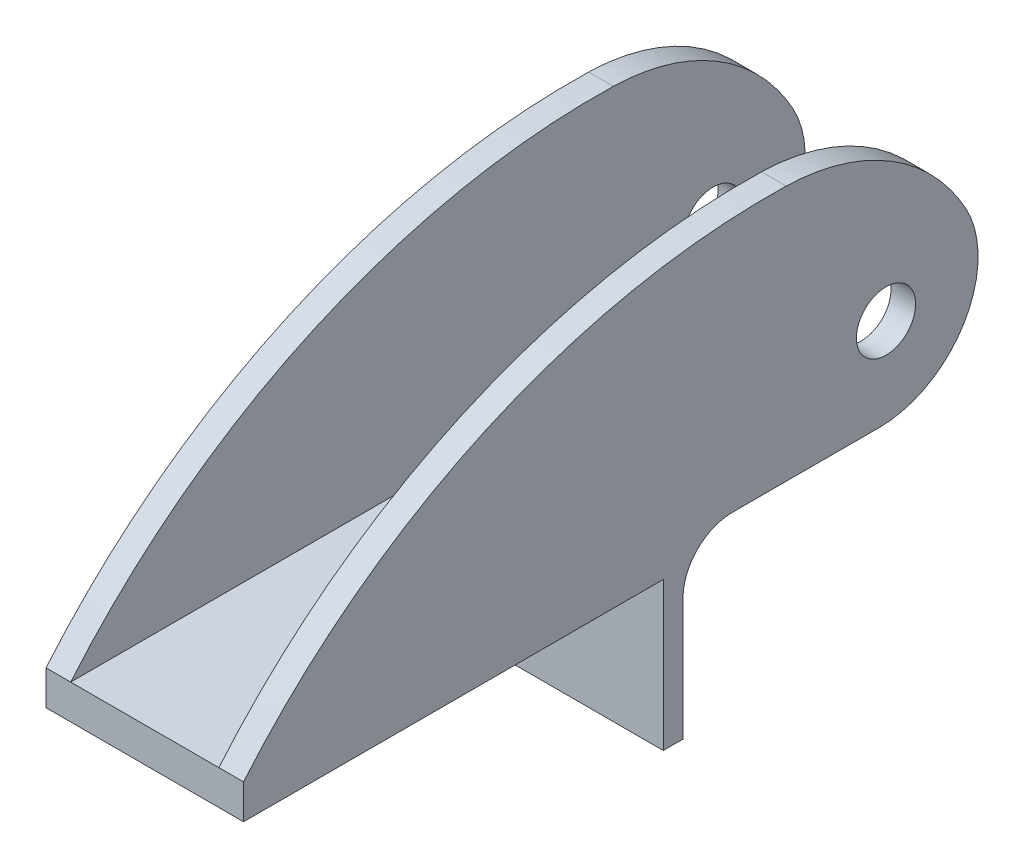
from build123d import *

# Parameters (mm, degrees)
SZKIC1_W                        = 30
SZKIC1_H                        = 75
DODANIE_WYCI_GNI_CIE1_DEPTH     = 4
DODANIE_WYCI_GNI_CIE9_DEPTH     = 5
ZAOKR_GLENIE4_START             = -20
ZAOKR_GLENIE4_DEPTH             = 6
ZAOKR_GLENIE7_START             = 14
ZAOKR_GLENIE7_DEPTH             = 6
SZKIC12_W                       = 30
SZKIC12_H                       = 85
DODANIE_WYCI_GNI_CIE14_DEPTH    = 7
SZKIC13_W                       = 30
SZKIC13_H                       = 38
WYTNIJ_WYCI_GNI_CIE3_DEPTH      = 10
ZAOKR_GLENIE10_R                = 20
WYTNIJ_WYCI_GNI_CIE4_DEPTH      = 108.491901733
WYTNIJ_WYCI_GNI_CIE4_DEPTH_BACK = 108.491901733
SZKIC16_R                       = 6
ZAOKR_GLENIE11_R                = 10


with BuildPart() as part:
    # Szkic1 → Dodanie-wyciągnięcie1 (new body)
    with BuildSketch(Plane.XY):
        Rectangle(SZKIC1_W, SZKIC1_H)
    extrude(amount=DODANIE_WYCI_GNI_CIE1_DEPTH)

    # Szkic2<6> → Dodanie-wyciągnięcie9 (add)
    with BuildSketch(Plane.ZY.offset(15)):
        with BuildLine():
            Line((-62.531345503, -2.73), (0, -2.73))
            Line((0, -2.73), (0, -37.5))
            Line((0, -37.5), (4, -37.5))
            Line((4, -37.5), (4, -7.5))
            Line((4, -7.5), (89, -7.5))
            Line((89, -7.5), (89, -0.5))
            ThreePointArc((89, -0.5), (36.533874177, 38.142707909), (-27.765672752, 48.703081871))
            Line((-27.765672752, 48.703081871), (-62.531345503, 37.27))
            Line((-62.531345503, 37.27), (-62.531345503, -2.73))
        make_face()
    dodanie_wyci_gni_cie9 = extrude(amount=DODANIE_WYCI_GNI_CIE9_DEPTH)

    # Zaokrąglenie4: read off the stored shape, not the designer's step
    # Zaokrąglenie4 outline → Zaokrąglenie4 (cut)
    with BuildSketch(Plane.YZ.offset(ZAOKR_GLENIE4_START)):
        with BuildLine():
            add(Edge.make_bspline(
                [(46.914284354, -33.205041576), (48.244794, -29.159256091), (48.938225425, -25.023538595), (49.036781903, -20.899990656)],
                knots=[0.800219325, 0.800219325, 0.800219325, 0.800219325, 1, 1, 1, 1], degree=3, weights=[0.909036421, 0.931787704, 0.962108897, 1]))
            Line((46.914284354, -33.205041576), (48.703081871, -27.765672752))
            ThreePointArc((48.703081871, -27.765672752), (48.912277268, -24.334889862), (49.036781903, -20.899990656))
        make_face()
        with BuildLine():
            add(Edge.make_bspline(
                [(6.398511186, -62.531345503), (25.138203193, -62.531345503), (40.842910838, -51.666745261), (46.914284354, -33.205041576)],
                knots=[0, 0, 0, 0, 0.800219325, 0.800219325, 0.800219325, 0.800219325], degree=3, weights=[1, 0.848227597, 0.817906404, 0.909036421]))
            Line((6.398511186, -62.531345503), (37.27, -62.531345503))
            Line((37.27, -62.531345503), (46.914284354, -33.205041576))
        make_face()
    extrude(amount=ZAOKR_GLENIE4_DEPTH, mode=Mode.SUBTRACT)

    # Lustro2: Dodanie-wyciągnięcie9 across plane
    add(dodanie_wyci_gni_cie9.mirror(Plane(origin=(0, 0, 0), x_dir=(0, 0, 1), z_dir=(1, 0, 0))))

    # Zaokrąglenie7: read off the stored shape, not the designer's step
    # Zaokrąglenie7 outline → Zaokrąglenie7 (cut)
    with BuildSketch(Plane.YZ.offset(ZAOKR_GLENIE7_START)):
        with BuildLine():
            ThreePointArc((48.703081871, -27.765672752), (48.912277268, -24.334889862), (49.036781903, -20.899990656))
            add(Edge.make_bspline(
                [(49.036781903, -20.899990656), (48.938225459, -25.023537174), (48.244794476, -29.159253258), (46.914285711, -33.205037449)],
                knots=[0, 0, 0, 0, 0.199780609, 0.199780609, 0.199780609, 0.199780609], degree=3, weights=[1, 0.962108909, 0.931787724, 0.909036443]))
            Line((46.914285711, -33.205037449), (48.703081871, -27.765672752))
        make_face()
        with BuildLine():
            Line((37.27, -62.531345503), (46.914285711, -33.205037449))
            add(Edge.make_bspline(
                [(46.914285711, -33.205037449), (40.842913536, -51.666743395), (25.138205022, -62.531345503), (6.398511186, -62.531345503)],
                knots=[0.199780609, 0.199780609, 0.199780609, 0.199780609, 1, 1, 1, 1], degree=3, weights=[0.909036443, 0.817906399, 0.848227585, 1]))
            Line((6.398511186, -62.531345503), (37.27, -62.531345503))
        make_face()
    extrude(amount=ZAOKR_GLENIE7_DEPTH, mode=Mode.SUBTRACT)

    # Szkic12 → Dodanie-wyciągnięcie14 (add)
    with BuildSketch(Plane.XZ.offset(7.5)):
        with Locations((0, 46.5)):
            Rectangle(SZKIC12_W, SZKIC12_H)
    extrude(amount=-DODANIE_WYCI_GNI_CIE14_DEPTH)

    # Szkic13 → Wytnij-wyciągnięcie3 (cut)
    with BuildSketch(Plane.XY.offset(4)):
        with Locations((0, 18.5)):
            Rectangle(SZKIC13_W, SZKIC13_H)
    extrude(amount=-WYTNIJ_WYCI_GNI_CIE3_DEPTH, mode=Mode.SUBTRACT)

    # Zaokrąglenie10
    zaokr_glenie10_edges = [part.edges().sort_by_distance(p)[0] for p in [
        (17.5, -2.73, -62.531345503),
        (-17.5, -2.73, -62.531345503),
    ]]
    fillet(zaokr_glenie10_edges, radius=ZAOKR_GLENIE10_R)

    # Szkic16 → Wytnij-wyciągnięcie4 (cut, two sides: drawn at the far end of the back side and taken through both)
    with BuildSketch(Plane(origin=(-15, 0, 0), x_dir=(0, 0, -1), z_dir=(1, 0, 0)).offset(-WYTNIJ_WYCI_GNI_CIE4_DEPTH_BACK)):
        with Locations((41.107158155, 15.269526453)):
            Circle(SZKIC16_R)
    extrude(amount=WYTNIJ_WYCI_GNI_CIE4_DEPTH + WYTNIJ_WYCI_GNI_CIE4_DEPTH_BACK, mode=Mode.SUBTRACT)

    # Zaokrąglenie11
    zaokr_glenie11_edges = [part.edges().sort_by_distance(p)[0] for p in [
        (-17.5, -2.73, 0),
        (17.5, -2.73, 0),
    ]]
    fillet(zaokr_glenie11_edges, radius=ZAOKR_GLENIE11_R)


solid = part.part
